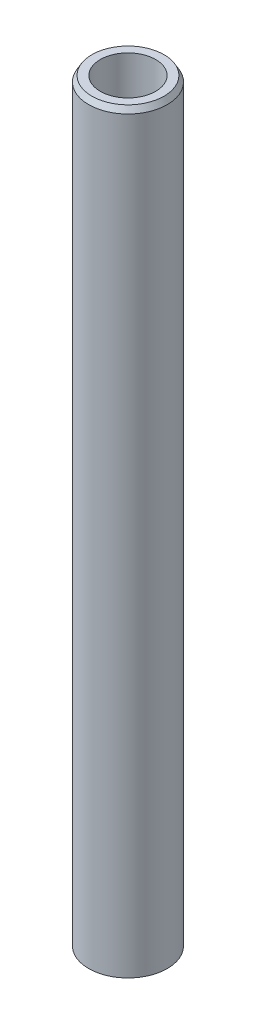
from build123d import *
from OCP.BRepFilletAPI import BRepFilletAPI_MakeChamfer

# Parameters (mm, degrees)
SKETCH1_R           = 15
BOSS_EXTRUDE1_DEPTH = 288.976468528
SKETCH2_R           = 10.555976411
CUT_EXTRUDE1_DEPTH  = 290.754032522
CHAMFER1_SIZE       = 2.161517262
CHAMFER1_SIZE2      = 1.247952573


with BuildPart() as part:
    # Sketch1 → Boss-Extrude1 (new body)
    with BuildSketch(Plane(origin=(0, 0, 0), x_dir=(1, 0, 0), z_dir=(0, 1, 0))):
        Circle(SKETCH1_R)
    extrude(amount=BOSS_EXTRUDE1_DEPTH)

    # Sketch2 → Cut-Extrude1 (cut, through all)
    with BuildSketch(Plane(origin=(0, 0, 0), x_dir=(1, 0, 0), z_dir=(0, 1, 0))):
        Circle(SKETCH2_R)
    extrude(amount=CUT_EXTRUDE1_DEPTH, mode=Mode.SUBTRACT)

    # Chamfer1: one chamfer whose edges measure the first distance from different faces: ONE call of the kernel's chamfer builder (chamfer() names one face for all edges)
    chamfer1_edges_1 = [part.edges().sort_by_distance(p)[0] for p in [
        (-15, 288.976468528, 0),
    ]]
    chamfer1_side_1 = [part.faces().sort_by_distance(p)[0] for p in [
        (-15, 144.488234264, 0),
    ]]
    chamfer1_edges_2 = [part.edges().sort_by_distance(p)[0] for p in [
        (-15, 0, 0),
    ]]
    chamfer1_side_2 = [part.faces().sort_by_distance(p)[0] for p in [
        (-14.575735931, 0, 0),
    ]]
    chamfer1 = BRepFilletAPI_MakeChamfer(part.part.solid().wrapped)
    for e in chamfer1_edges_1:
        chamfer1.Add(CHAMFER1_SIZE, CHAMFER1_SIZE2, e.wrapped, chamfer1_side_1[0].wrapped)  # the first distance lies on this face
    for e in chamfer1_edges_2:
        chamfer1.Add(CHAMFER1_SIZE, CHAMFER1_SIZE2, e.wrapped, chamfer1_side_2[0].wrapped)  # the first distance lies on this face
    add(Compound.cast(chamfer1.Shape()), mode=Mode.REPLACE)


solid = part.part
